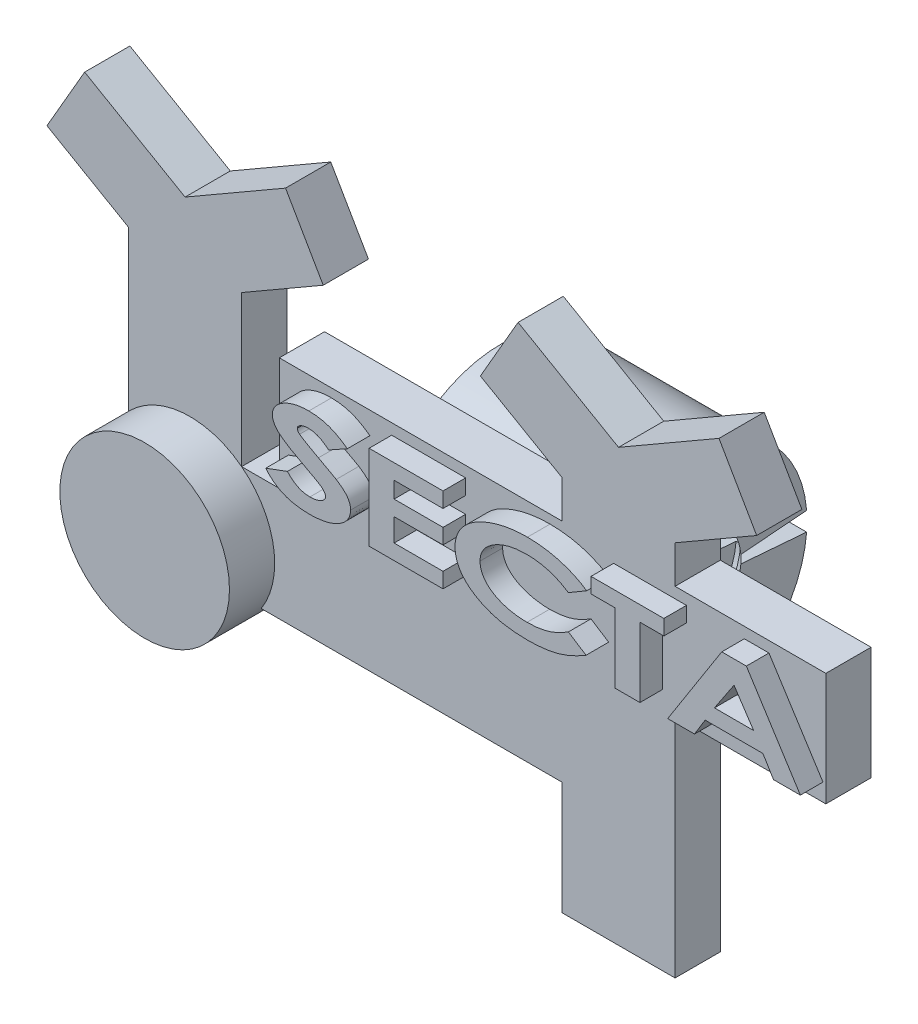
from build123d import *

# Parameters (mm, degrees)
SALIENTE_EXTRUIR1_DEPTH      = 2.4
SALIENTE_EXTRUIR2_DEPTH      = 2.4
SALIENTE_EXTRUIR2_DEPTH_BACK = 2.4
CROQUIS2_R                   = 4.5
SALIENTE_EXTRUIR3_DEPTH      = 1.2
SALIENTE_EXTRUIR4_START      = -15.5
SALIENTE_EXTRUIR4_DEPTH      = 10
REVOLUCI_N2_ANGLE            = 350.852157


# Read off the part's stored shape, not the designer's step: Revolución2
with BuildPart() as part:
    # Croquis1 → Saliente-Extruir1 (new body)
    with BuildSketch(Plane.XY):
        Polygon((-8, -12), (-14, -12), (-14, -6), (-37, -6), (-37, 8), (-41.330127019, 10.5), (-39.330127019, 13.964101615), (-34, 10.886751346), (-28.669872981, 13.964101615), (-26.669872981, 10.5), (-31, 8), (-31, 0), (-29, 0), (-29, 6), (-14, 6), (-14, 8), (-18.330127019, 10.5), (-16.330127019, 13.964101615), (-11, 10.886751346), (-5.669872981, 13.964101615), (-3.669872981, 10.5), (-8, 8), (-8, 6), (0, 6), (0, 0), (-8, 0), align=None)
    extrude(amount=SALIENTE_EXTRUIR1_DEPTH)

    # Croquis2 → Saliente-Extruir2 (add, two sides: drawn at the far end of the back side and taken through both)
    with BuildSketch(Plane.XY.offset(2.4).offset(-SALIENTE_EXTRUIR2_DEPTH_BACK)):
        with Locations((-33.744908232, -3.565877002)):
            Circle(CROQUIS2_R)
    extrude(amount=SALIENTE_EXTRUIR2_DEPTH + SALIENTE_EXTRUIR2_DEPTH_BACK)

    # Croquis4 → Saliente-Extruir3 (add)
    # profile 1 of 5: a face of its own
    with BuildSketch(Plane.XY.offset(2.4)):
        with BuildLine():
            Line((-24.192307692, 4.825075565), (-25.183894231, 4.27249143))
            add(Edge.make_bspline(
                [(-25.183894231, 4.27249143), (-25.226919521, 4.309235401), (-25.310921586, 4.380973891), (-25.44300624, 4.474503478), (-25.57494017, 4.554736812), (-25.707934149, 4.620047496), (-25.841884622, 4.67105453), (-25.976583426, 4.707083688), (-26.111905597, 4.729870519), (-26.20243685, 4.732645607), (-26.247596154, 4.734029892)],
                knots=[0, 0, 0, 0, 1.144796943, 2.235087903, 3.271950806, 4.267549238, 5.230026978, 6.168390537, 7.086346384, 8, 8, 8, 8], degree=3))
            add(Edge.make_bspline(
                [(-26.247596154, 4.734029892), (-26.289424602, 4.733153893), (-26.369562474, 4.731475594), (-26.484031555, 4.714354255), (-26.586771926, 4.685665755), (-26.6761846, 4.647005328), (-26.748660996, 4.600831216), (-26.803911953, 4.552167689), (-26.838911098, 4.497375224), (-26.84382007, 4.457984847), (-26.846153846, 4.439258257)],
                knots=[0, 0, 0, 0, 1.392129176, 2.667138632, 3.84227936, 4.935454925, 5.89858118, 6.691521191, 7.377935727, 8, 8, 8, 8], degree=3))
            add(Edge.make_bspline(
                [(-26.846153846, 4.439258257), (-26.844845537, 4.420373796), (-26.842149476, 4.381458201), (-26.816134665, 4.325733024), (-26.777704966, 4.271256116), (-26.742929276, 4.240270627), (-26.724459135, 4.223813546)],
                knots=[0, 0, 0, 0, 0.882707917, 1.819014285, 2.841630067, 4, 4, 4, 4], degree=3))
            add(Edge.make_bspline(
                [(-26.724459135, 4.223813546), (-26.70716928, 4.210697442), (-26.66689923, 4.180148536), (-26.59337581, 4.132820466), (-26.500289619, 4.0742192), (-26.385267259, 4.007155467), (-26.250202075, 3.929117481), (-26.092994818, 3.843681459), (-25.91659167, 3.74531642), (-25.790990693, 3.678511715), (-25.724759615, 3.643284699)],
                knots=[0, 0, 0, 0, 0.450074539, 1.048275106, 1.812777656, 2.732189609, 3.810011812, 5.048794557, 6.443789853, 8, 8, 8, 8], degree=3))
            add(Edge.make_bspline(
                [(-25.724759615, 3.643284699), (-25.662851598, 3.61054962), (-25.545567289, 3.548533238), (-25.379215317, 3.460234009), (-25.232592385, 3.380629208), (-25.104381152, 3.311837263), (-24.996313352, 3.251000464), (-24.90672063, 3.20082688), (-24.836479309, 3.15950506), (-24.796241404, 3.134624323), (-24.779146635, 3.12405393)],
                knots=[0, 0, 0, 0, 1.557729856, 2.951108395, 4.189202345, 5.268860485, 6.187465346, 6.947688418, 7.552933379, 8, 8, 8, 8], degree=3))
            add(Edge.make_bspline(
                [(-24.779146635, 3.12405393), (-24.745624529, 3.102367723), (-24.680599264, 3.060301409), (-24.588625488, 2.994912237), (-24.503390955, 2.931503644), (-24.427229566, 2.867043774), (-24.357014925, 2.805015658), (-24.29466236, 2.742739252), (-24.239952943, 2.680948997), (-24.177464976, 2.600954471), (-24.114353967, 2.498189698), (-24.058957494, 2.368077238), (-24.025432867, 2.231810055), (-24.021303487, 2.138659077), (-24.019230769, 2.091902488)],
                knots=[0, 0, 0, 0, 1.070878652, 2.077261218, 3.026806543, 3.919535016, 4.752941277, 5.539501526, 6.28186576, 6.965498631, 8.260851439, 9.503440935, 10.746866769, 12, 12, 12, 12], degree=3))
            add(Edge.make_bspline(
                [(-24.019230769, 2.091902488), (-24.021225883, 2.046388603), (-24.025162066, 1.956593709), (-24.053916989, 1.824825276), (-24.101962891, 1.699615496), (-24.170078124, 1.580956355), (-24.25688378, 1.468643362), (-24.361997442, 1.361487696), (-24.488019379, 1.263070384), (-24.629645969, 1.169520308), (-24.787082803, 1.085611466), (-24.956963559, 1.011461598), (-25.138821289, 0.94934789), (-25.33212297, 0.899368812), (-25.536835489, 0.859635813), (-25.752947944, 0.83114072), (-25.980779388, 0.81366997), (-26.136386151, 0.811872926), (-26.216045673, 0.810952969)],
                knots=[0, 0, 0, 0, 0.778645729, 1.536199556, 2.296471887, 3.065788088, 3.869161519, 4.720163113, 5.627776405, 6.600599383, 7.622238928, 8.677086202, 9.770036052, 10.907689888, 12.091823603, 13.337058766, 14.636764725, 16, 16, 16, 16], degree=3))
            add(Edge.make_bspline(
                [(-26.216045673, 0.810952969), (-26.278862692, 0.811613903), (-26.402188738, 0.812911487), (-26.584138058, 0.824072309), (-26.75981156, 0.841825212), (-26.929760665, 0.867140244), (-27.09350231, 0.899245573), (-27.251131566, 0.939142332), (-27.402545238, 0.985888772), (-27.54819372, 1.039742336), (-27.687679504, 1.102538784), (-27.822154113, 1.17262053), (-27.951366726, 1.251594628), (-28.076264597, 1.337864302), (-28.194814057, 1.433872974), (-28.309206927, 1.536758813), (-28.417527902, 1.648872099), (-28.485118563, 1.728831552), (-28.519230769, 1.769186142)],
                knots=[0, 0, 0, 0, 1.1656978, 2.288566092, 3.381684239, 4.4416263, 5.476209922, 6.477059963, 7.457759757, 8.415892537, 9.356930802, 10.29479133, 11.228214832, 12.165660798, 13.10971789, 14.057260176, 15.019522194, 16, 16, 16, 16], degree=3))
            Line((-28.519230769, 1.769186142), (-27.369891827, 2.195568353))
            add(Edge.make_bspline(
                [(-27.369891827, 2.195568353), (-27.326878803, 2.149617425), (-27.242766395, 2.059759915), (-27.104823389, 1.942623324), (-26.962827441, 1.842220632), (-26.815241766, 1.760731057), (-26.662944246, 1.696978834), (-26.505695985, 1.651714203), (-26.343252193, 1.623681536), (-26.232984667, 1.620335505), (-26.177283654, 1.618645276)],
                knots=[0, 0, 0, 0, 1.104549774, 2.159958392, 3.171518491, 4.154034384, 5.11440821, 6.064653456, 7.02237072, 8, 8, 8, 8], degree=3))
            add(Edge.make_bspline(
                [(-26.177283654, 1.618645276), (-26.120989658, 1.62005089), (-26.012343754, 1.622763687), (-25.85664514, 1.64771586), (-25.713942821, 1.686386449), (-25.607218871, 1.734622992), (-25.53095931, 1.778258902), (-25.482277778, 1.812604775), (-25.440114595, 1.847701985), (-25.405740827, 1.884529266), (-25.378809327, 1.92260654), (-25.360756038, 1.962489796), (-25.347985789, 2.003075864), (-25.346761569, 2.031110582), (-25.346153846, 2.045027488)],
                knots=[0, 0, 0, 0, 2.000080528, 3.860101882, 5.591711695, 7.241573856, 8.007496713, 8.712915002, 9.3571957, 9.95440764, 10.499672279, 11.006310789, 11.506715953, 12, 12, 12, 12], degree=3))
            add(Edge.make_bspline(
                [(-25.346153846, 2.045027488), (-25.348239201, 2.070942283), (-25.352586387, 2.124964954), (-25.390964671, 2.203007862), (-25.448179949, 2.280722516), (-25.514214503, 2.343308112), (-25.582059449, 2.395058844), (-25.647383562, 2.441422812), (-25.726444628, 2.492094868), (-25.819005406, 2.548325637), (-25.925335169, 2.609220624), (-26.044860486, 2.67577012), (-26.17800202, 2.747266769), (-26.271568792, 2.795754085), (-26.320612981, 2.821169315)],
                knots=[0, 0, 0, 0, 0.719620744, 1.500140495, 2.382110041, 3.407752025, 4.023146351, 4.762800511, 5.641737031, 6.64237355, 7.784062873, 9.059959673, 10.45894125, 12, 12, 12, 12], degree=3))
            add(Edge.make_bspline(
                [(-26.320612981, 2.821169315), (-26.368459463, 2.84567455), (-26.462008447, 2.89358695), (-26.598052081, 2.966124363), (-26.728282458, 3.035606872), (-26.852361866, 3.102717503), (-26.969340368, 3.16861793), (-27.079874913, 3.232097137), (-27.184213841, 3.292789495), (-27.281477135, 3.352655417), (-27.372939784, 3.409563727), (-27.457987116, 3.463803993), (-27.536153138, 3.516806133), (-27.608250882, 3.56691886), (-27.673715651, 3.615399427), (-27.732827542, 3.661463412), (-27.784903573, 3.705640291), (-27.845809442, 3.760123378), (-27.91153798, 3.827869305), (-27.981090217, 3.909608617), (-28.039650506, 3.991311051), (-28.088116794, 4.07325264), (-28.126508849, 4.154820462), (-28.152520589, 4.237055511), (-28.169956374, 4.318632083), (-28.172042788, 4.37336685), (-28.173076923, 4.400496238)],
                knots=[0, 0, 0, 0, 1.527752317, 2.987046655, 4.381534809, 5.722815918, 6.996037519, 8.197198144, 9.345466108, 10.426340658, 11.442891163, 12.407010941, 13.292840506, 14.126765819, 14.902190045, 15.60773904, 16.256140062, 16.842652159, 17.929649168, 18.935598672, 19.890598399, 20.782540177, 21.638432253, 22.445922123, 23.229718433, 24, 24, 24, 24], degree=3))
            add(Edge.make_bspline(
                [(-28.173076923, 4.400496238), (-28.171332958, 4.439115335), (-28.167872434, 4.515746655), (-28.140274372, 4.628176318), (-28.096954996, 4.736645399), (-28.034402099, 4.840036268), (-27.954790236, 4.939178338), (-27.857594728, 5.03372198), (-27.743147048, 5.123864571), (-27.613030887, 5.208721489), (-27.469978861, 5.28611098), (-27.317394775, 5.354995406), (-27.156225026, 5.412373324), (-26.987382795, 5.460394313), (-26.810220466, 5.497174122), (-26.625035089, 5.523120736), (-26.431752744, 5.538517619), (-26.300208347, 5.540640417), (-26.233173077, 5.541722199)],
                knots=[0, 0, 0, 0, 0.750986067, 1.490170878, 2.240724014, 3.017156197, 3.83291239, 4.709793601, 5.650705905, 6.664670556, 7.729957895, 8.813839263, 9.920261115, 11.057155333, 12.228423976, 13.439459984, 14.695144019, 16, 16, 16, 16], degree=3))
            add(Edge.make_bspline(
                [(-26.233173077, 5.541722199), (-26.1459499, 5.539811999), (-25.973426712, 5.536033716), (-25.71789947, 5.506014802), (-25.468743649, 5.458927461), (-25.265554368, 5.401927605), (-25.104286181, 5.345639344), (-24.980879285, 5.295174591), (-24.855593259, 5.235928582), (-24.726973154, 5.170437519), (-24.596827454, 5.094993964), (-24.463217184, 5.013324641), (-24.327779063, 4.922853281), (-24.238080357, 4.85811241), (-24.192307692, 4.825075565)],
                knots=[0, 0, 0, 0, 1.424089512, 2.816779558, 4.195891129, 5.561527259, 6.25835624, 6.984627267, 7.737611116, 8.521108524, 9.34096556, 10.193521101, 11.07816558, 12, 12, 12, 12], degree=3))
        make_face()
    # profile 2 of 5: a face of its own
    with BuildSketch(Plane.XY.offset(2.4)):
        Polygon((-23.035576923, 5.426337584), (-19.1125, 5.426337584), (-19.1125, 4.618645276), (-21.708653846, 4.618645276), (-21.708653846, 3.753260661), (-19.1125, 3.753260661), (-19.1125, 2.945568353), (-21.708653846, 2.945568353), (-21.708653846, 1.734029892), (-19.1125, 1.734029892), (-19.1125, 0.926337584), (-23.035576923, 0.926337584), align=None)
    # profile 3 of 5: a face of its own
    with BuildSketch(Plane.XY.offset(2.4)):
        with BuildLine():
            Line((-11.494230769, 4.645688546), (-12.461478365, 4.079582776))
            add(Edge.make_bspline(
                [(-12.461478365, 4.079582776), (-12.544289436, 4.131887712), (-12.70893723, 4.235882169), (-12.967709373, 4.369570214), (-13.2349627, 4.481070871), (-13.508945238, 4.574844948), (-13.791643594, 4.64568237), (-14.081359757, 4.697070998), (-14.379043474, 4.728675173), (-14.580090964, 4.732231823), (-14.681730769, 4.734029892)],
                knots=[0, 0, 0, 0, 1.000465043, 1.98915872, 2.971640436, 3.957111076, 4.945256385, 5.94622067, 6.961709345, 8, 8, 8, 8], degree=3))
            add(Edge.make_bspline(
                [(-14.681730769, 4.734029892), (-14.766807302, 4.732614733), (-14.933613121, 4.729840095), (-15.178736129, 4.708948819), (-15.41352726, 4.673751146), (-15.638708179, 4.625507751), (-15.853448947, 4.562274824), (-16.058280977, 4.48569033), (-16.25235326, 4.394501415), (-16.434067486, 4.290723345), (-16.600277398, 4.177562223), (-16.746196027, 4.055929366), (-16.870201552, 3.927577603), (-16.971329203, 3.792162), (-17.051341788, 3.650423272), (-17.107374496, 3.501164008), (-17.142253146, 3.345315182), (-17.146123081, 3.239018692), (-17.148076923, 3.185352007)],
                knots=[0, 0, 0, 0, 1.273167119, 2.496242804, 3.678550535, 4.824339787, 5.939965159, 7.025799381, 8.094030328, 9.145459928, 10.154579224, 11.099447358, 11.983659447, 12.819211474, 13.622469174, 14.41092516, 15.197712182, 16, 16, 16, 16], degree=3))
            add(Edge.make_bspline(
                [(-17.148076923, 3.185352007), (-17.147415614, 3.147727083), (-17.146108387, 3.073352918), (-17.129475318, 2.96370395), (-17.106065882, 2.856804626), (-17.070101266, 2.75393244), (-17.025862091, 2.65391101), (-16.971328936, 2.557174091), (-16.907261742, 2.463244728), (-16.833169017, 2.37324015), (-16.74995472, 2.287330187), (-16.657794645, 2.206639788), (-16.558275277, 2.129695963), (-16.45080782, 2.057129788), (-16.334226304, 1.991157083), (-16.210216908, 1.928324455), (-16.077791861, 1.871334993), (-15.938537212, 1.817777173), (-15.792564168, 1.771701839), (-15.642458064, 1.729774273), (-15.487700082, 1.69568223), (-15.329102464, 1.668203354), (-15.166867918, 1.644955994), (-15.000433419, 1.63053195), (-14.830012806, 1.619621949), (-14.714802376, 1.618973486), (-14.656490385, 1.618645276)],
                knots=[0, 0, 0, 0, 0.830945717, 1.642551973, 2.446594014, 3.246896049, 4.046756933, 4.861591236, 5.698014292, 6.556999256, 7.435410672, 8.338952563, 9.262321444, 10.214761384, 11.20258315, 12.221471147, 13.286409055, 14.388022435, 15.518142965, 16.668710983, 17.832243558, 19.019275871, 20.22635821, 21.453738207, 22.71124865, 24, 24, 24, 24], degree=3))
            add(Edge.make_bspline(
                [(-14.656490385, 1.618645276), (-14.558479025, 1.620411909), (-14.366006122, 1.623881189), (-14.084005172, 1.650038065), (-13.814796067, 1.694421697), (-13.598352905, 1.745650094), (-13.428470487, 1.797304223), (-13.29967663, 1.845079594), (-13.16705737, 1.897774166), (-13.031696922, 1.95876245), (-12.892716193, 2.025958407), (-12.751716033, 2.102246686), (-12.606883075, 2.184160309), (-12.51058721, 2.243056557), (-12.461478365, 2.273092392)],
                knots=[0, 0, 0, 0, 1.517099692, 2.97925243, 4.379421106, 5.737784246, 6.419017464, 7.126793621, 7.863581755, 8.627744198, 9.42450828, 10.252748223, 11.108938718, 12, 12, 12, 12], degree=3))
            Line((-12.461478365, 2.273092392), (-11.523978365, 1.670027488))
            add(Edge.make_bspline(
                [(-11.523978365, 1.670027488), (-11.589866389, 1.63089097), (-11.719693426, 1.55377562), (-11.915195728, 1.446317988), (-12.108473976, 1.34948377), (-12.297754192, 1.259261056), (-12.485165811, 1.179927018), (-12.670221171, 1.111080552), (-12.851582723, 1.048595885), (-13.032422653, 0.997560002), (-13.21480409, 0.952437403), (-13.402047536, 0.915306611), (-13.595238215, 0.882366907), (-13.794974582, 0.856691538), (-14.000848718, 0.835695517), (-14.213133376, 0.821796079), (-14.43134112, 0.812187513), (-14.578955449, 0.81136827), (-14.653786058, 0.810952969)],
                knots=[0, 0, 0, 0, 1.116919084, 2.20079896, 3.250609473, 4.267388355, 5.256504417, 6.215552819, 7.144850743, 8.051425286, 8.95323759, 9.882566473, 10.832956071, 11.809130983, 12.817090507, 13.848664173, 14.909416376, 16, 16, 16, 16], degree=3))
            add(Edge.make_bspline(
                [(-14.653786058, 0.810952969), (-14.722906065, 0.811438621), (-14.859691786, 0.812399709), (-15.062555949, 0.821077022), (-15.260983826, 0.833250386), (-15.454582999, 0.851296303), (-15.643403282, 0.874597786), (-15.827259539, 0.903853507), (-16.00674088, 0.936332544), (-16.180825441, 0.976788095), (-16.350605366, 1.020454944), (-16.515219787, 1.070284035), (-16.675796791, 1.124137214), (-16.830986852, 1.184720215), (-16.98194907, 1.249284398), (-17.127583541, 1.320151969), (-17.268666888, 1.395536662), (-17.404785058, 1.475557845), (-17.533832281, 1.55977608), (-17.655328935, 1.647304488), (-17.767608154, 1.738530782), (-17.872942194, 1.831381532), (-17.969705449, 1.927659287), (-18.056733746, 2.028066389), (-18.136984543, 2.130125749), (-18.207982429, 2.23578825), (-18.271536331, 2.343875109), (-18.325588208, 2.45528507), (-18.371881381, 2.569350723), (-18.409889173, 2.686463496), (-18.438566401, 2.80681331), (-18.459258447, 2.929679867), (-18.472299239, 3.055565471), (-18.474092593, 3.140548909), (-18.475, 3.183549122)],
                knots=[0, 0, 0, 0, 1.332695775, 2.637351488, 3.914573827, 5.165626706, 6.385872522, 7.582268218, 8.755001435, 9.901903064, 11.027533841, 12.134657037, 13.217484645, 14.292362361, 15.346028539, 16.38254251, 17.414187142, 18.429713001, 19.426050768, 20.38448865, 21.315585414, 22.214377371, 23.09110566, 23.945180852, 24.774994998, 25.592932072, 26.397837579, 27.190746929, 27.978303889, 28.769836126, 29.562406716, 30.361557218, 31.170975064, 32, 32, 32, 32], degree=3))
            add(Edge.make_bspline(
                [(-18.475, 3.183549122), (-18.473785493, 3.238925736), (-18.471371684, 3.348985679), (-18.446835338, 3.511020848), (-18.408980933, 3.668635775), (-18.355790343, 3.821267368), (-18.28636546, 3.9692084), (-18.202723551, 4.112393918), (-18.103189381, 4.250700647), (-17.988581396, 4.383672271), (-17.859872774, 4.511467458), (-17.71720785, 4.632192986), (-17.563026633, 4.748488266), (-17.393828314, 4.855888833), (-17.21236255, 4.957872305), (-17.017950151, 5.05352182), (-16.810256436, 5.142613144), (-16.59063275, 5.224912925), (-16.362332555, 5.299148216), (-16.12837035, 5.364251973), (-15.889855412, 5.419259798), (-15.647178925, 5.464408476), (-15.399824695, 5.498220768), (-15.148529856, 5.52396688), (-14.892531391, 5.538130641), (-14.720508462, 5.540519988), (-14.633954327, 5.541722199)],
                knots=[0, 0, 0, 0, 0.802734483, 1.595419208, 2.3713548, 3.151550955, 3.93542733, 4.738280132, 5.553519112, 6.40352961, 7.281897666, 8.181549112, 9.112540013, 10.080976543, 11.086002615, 12.130796417, 13.222189586, 14.362844853, 15.53167316, 16.70335042, 17.8843298, 19.081152094, 20.282513389, 21.504662868, 22.744459539, 24, 24, 24, 24], degree=3))
            add(Edge.make_bspline(
                [(-14.633954327, 5.541722199), (-14.560022202, 5.541038651), (-14.412680101, 5.539676383), (-14.192915704, 5.528419291), (-13.974866237, 5.510811627), (-13.759430794, 5.484144557), (-13.545483627, 5.45221806), (-13.334339569, 5.411070758), (-13.124506008, 5.364772576), (-12.918162654, 5.309484781), (-12.715876611, 5.248900726), (-12.520332919, 5.18093532), (-12.331084533, 5.108255242), (-12.149648163, 5.028005632), (-11.974851405, 4.94211841), (-11.807351876, 4.850530483), (-11.646999565, 4.75209108), (-11.544984001, 4.681037862), (-11.494230769, 4.645688546)],
                knots=[0, 0, 0, 0, 1.07027023, 2.132981633, 3.184963682, 4.2365859, 5.275089204, 6.31594048, 7.35020766, 8.385325281, 9.407824875, 10.406591267, 11.38165812, 12.34189163, 13.277662355, 14.200461515, 15.104720988, 16, 16, 16, 16], degree=3))
        make_face()
    # profile 4 of 5: a face of its own
    with BuildSketch(Plane.XY.offset(2.4)):
        Polygon((-11.260576923, 5.426337584), (-7.395192308, 5.426337584), (-7.395192308, 4.618645276), (-8.664423077, 4.618645276), (-8.664423077, 0.926337584), (-9.991346154, 0.926337584), (-9.991346154, 4.618645276), (-11.260576923, 4.618645276), align=None)
    # profile 5 of 5: a face of its own
    with BuildSketch(Plane.XY.offset(2.4)):
        Polygon((-4.322896635, 5.426337584), (-3.017608173, 5.426337584), (-0.151923077, 0.926337584), (-1.574399038, 0.926337584), (-2.138701923, 1.849414507), (-5.204507212, 1.849414507), (-5.768810096, 0.926337584), (-7.190384615, 0.926337584), align=None)
        Polygon((-3.671153846, 4.219306334), (-4.710516827, 2.657106815), (-2.631790865, 2.657106815), align=None, mode=Mode.SUBTRACT)
    extrude(amount=SALIENTE_EXTRUIR3_DEPTH)

    # Croquis5 → Saliente-Extruir4 (add)
    with BuildSketch(Plane.ZY.offset(29).offset(SALIENTE_EXTRUIR4_START)):
        with BuildLine():
            Line((0, 4.92341345), (0, -4.92341345))
            ThreePointArc((0, -4.92341345), (-6.362246553, -5.722859186), (-10.080095491, -0.498407639))
            Line((-10.080095491, -0.498407639), (-7.588057295, -0.299044584))
            ThreePointArc((-7.588057295, -0.299044584), (-0.1, 0), (-7.588057295, 0.299044584))
            Line((-7.588057295, 0.299044584), (-10.080095491, 0.498407639))
            ThreePointArc((-10.080095491, 0.498407639), (-6.362246553, 5.722859186), (0, 4.92341345))
        make_face()
    extrude(amount=SALIENTE_EXTRUIR4_DEPTH)

    # Revolución2 outline → Revolución2 (revolve)
    with BuildSketch(Plane(origin=(0, 0, -3.85), x_dir=(0, 0.07974522228288873, -0.9968152785361251), z_dir=(0, -0.9968152785361251, -0.07974522228288873))):
        Polygon((3.75, -22.5), (2.75, -23.5), (3.75, -23.5), align=None)
        Polygon((2.75, -22.25), (3.75, -22.25), (3.75, -21.25), align=None)
        Polygon((2.75, -21), (3.75, -21), (3.75, -20), align=None)
        Polygon((2.75, -16), (3.75, -17), (3.75, -16), align=None)
        Polygon((2.75, -14.75), (3.75, -15.75), (3.75, -14.75), align=None)
        Polygon((2.75, -13.5), (3.75, -14.5), (3.75, -13.5), align=None)
    revolve(axis=Axis((0, 0, -3.85), (1, 0, 0)), revolution_arc=REVOLUCI_N2_ANGLE)


solid = part.part
